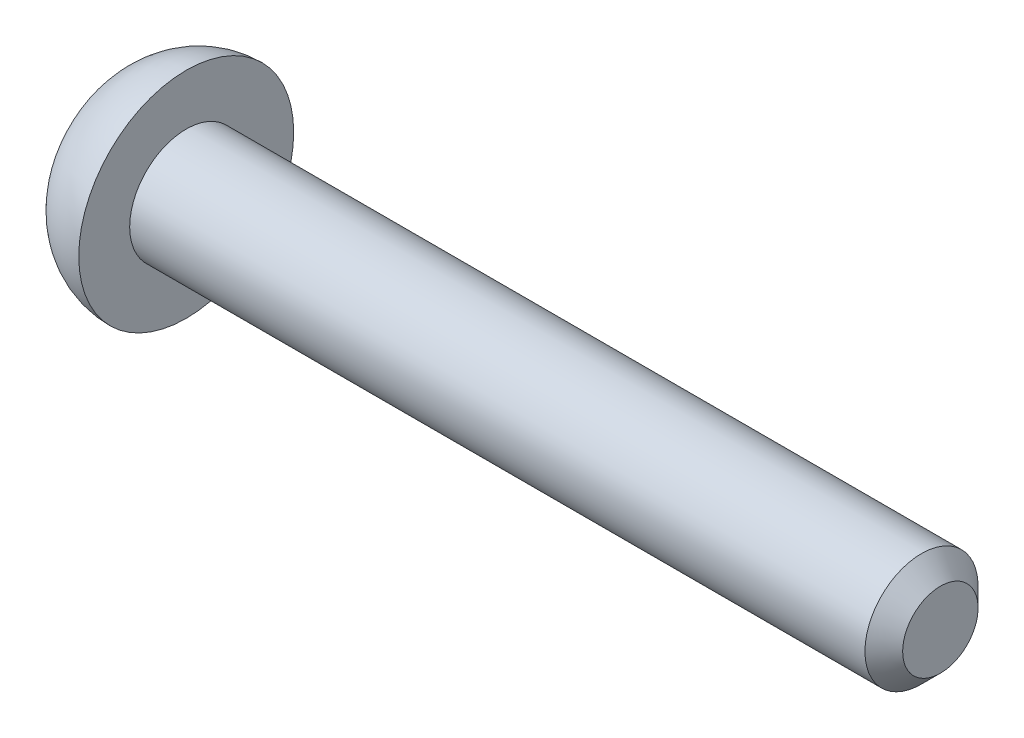
from build123d import *

# Parameters (mm, degrees)
CHAMFER1_SIZE      = 0.5
CUT_EXTRUDE1_DEPTH = 1


with BuildPart() as part:
    # Sketch2 → Revolve1 (revolve)
    with BuildSketch(Plane(origin=(0, 0, 0), x_dir=(1, 0, 0), z_dir=(0, 1, 0))):
        with BuildLine():
            Line((0, 0), (0, 1.5))
            Line((0, 1.5), (-20, 1.5))
            Line((-20, 1.5), (-20, 2.85))
            ThreePointArc((-20, 2.85), (-20.917065968, 2.639177072), (-21.65, 2.049038106))
            Line((-21.65, 2.049038106), (-21.65, 0))
            Line((-21.65, 0), (0, 0))
        make_face()
    revolve(axis=Axis((-21.65, 0, 0), (1, 0, 0)))

    # Chamfer1
    chamfer1_edges = [part.edges().sort_by_distance(p)[0] for p in [
        (0, 0, 1.5),
    ]]
    chamfer(chamfer1_edges, length=CHAMFER1_SIZE)

    # Sketch4 → Cut-Extrude1 (cut)
    with BuildSketch(Plane.ZY.offset(21.65)):
        with BuildLine():
            ThreePointArc((-1.342027284, 0.090739778), (-0.883315009, 0.509982158), (-0.749596595, 1.116859832))
            ThreePointArc((-0.749596595, 1.116859832), (-0.7, 1.212435565), (-0.592430689, 1.20759961))
            ThreePointArc((-0.592430689, 1.20759961), (0, 1.019964317), (0.592430689, 1.20759961))
            ThreePointArc((0.592430689, 1.20759961), (0.7, 1.212435565), (0.749596595, 1.116859832))
            ThreePointArc((0.749596595, 1.116859832), (0.883315009, 0.509982158), (1.342027284, 0.090739778))
            ThreePointArc((1.342027284, 0.090739778), (1.4, 0), (1.342027284, -0.090739778))
            ThreePointArc((1.342027284, -0.090739778), (0.883315009, -0.509982158), (0.749596595, -1.116859832))
            ThreePointArc((0.749596595, -1.116859832), (0.7, -1.212435565), (0.592430689, -1.20759961))
            ThreePointArc((0.592430689, -1.20759961), (0, -1.019964317), (-0.592430689, -1.20759961))
            ThreePointArc((-0.592430689, -1.20759961), (-0.7, -1.212435565), (-0.749596595, -1.116859832))
            ThreePointArc((-0.749596595, -1.116859832), (-0.883315009, -0.509982158), (-1.342027284, -0.090739778))
            ThreePointArc((-1.342027284, -0.090739778), (-1.4, 0), (-1.342027284, 0.090739778))
        make_face()
    extrude(amount=-CUT_EXTRUDE1_DEPTH, mode=Mode.SUBTRACT)


solid = part.part
